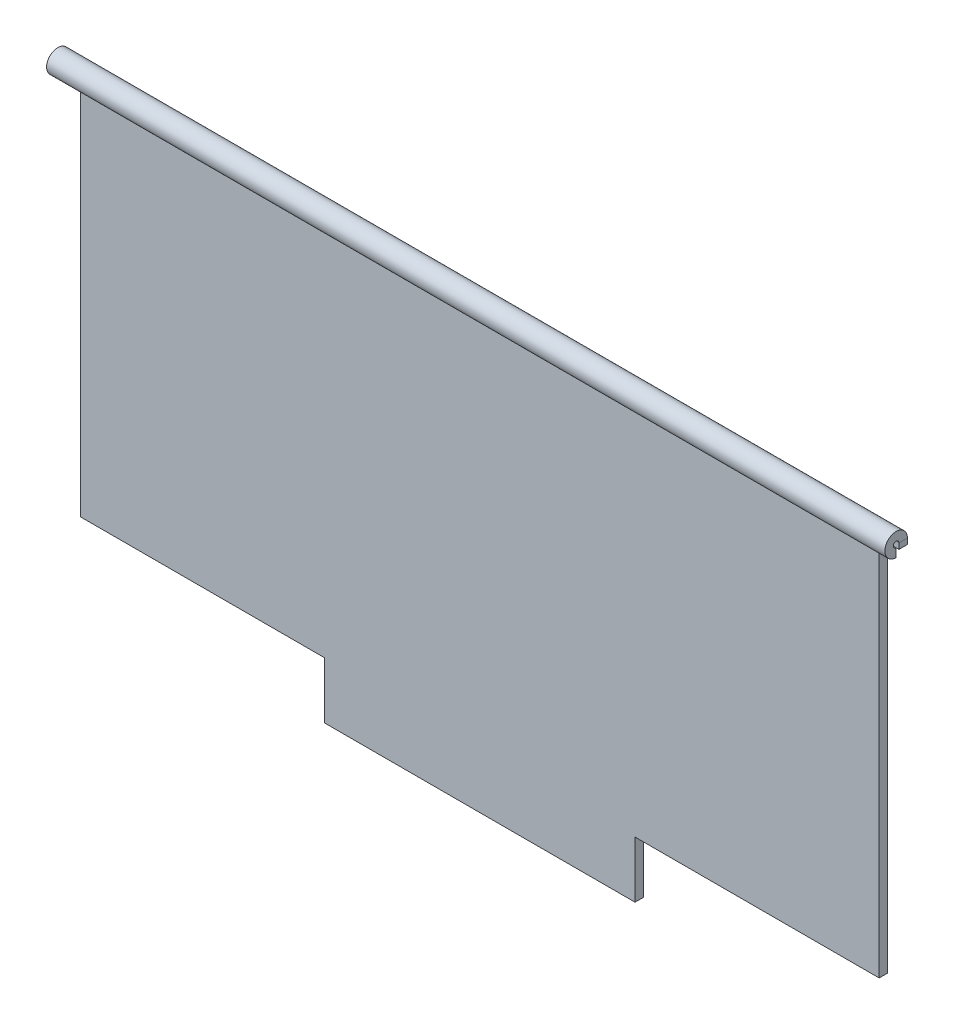
from build123d import *

# Parameters (mm, degrees)
BASE_FLANGE1_DEPTH = 3
HEM1_START         = -185.00035483
HEM1_DEPTH         = 297
HEM1_2_DEPTH       = 297


# Read off the part's stored shape, not the designer's step: Hem1
# Sheet-metal steps are written as plain solids
with BuildPart() as part:
    # Sketch1 → Base-Flange1 (new body)
    with BuildSketch(Plane.XY):
        Polygon((18.49964517, -243.314393939), (104.99964517, -243.314393939), (104.99964517, -108.314393939), (111.99964517, -108.314393939), (111.99964517, -102.314393939), (-185.00035483, -102.314393939), (-185.00035483, -108.314393939), (-178.00035483, -108.314393939), (-178.00035483, -243.314393939), (-91.50035483, -243.314393939), (-91.50035483, -263.314393939), (18.49964517, -263.314393939), align=None)
    extrude(amount=-BASE_FLANGE1_DEPTH)

    # Hem1 outline → Hem1 (cut)
    with BuildSketch(Plane.YZ.offset(HEM1_START)):
        with BuildLine():
            Line((-102.314393939, 0), (-102.441410593, 0))
            ThreePointArc((-102.441410593, 0), (-103.864904196, -2.16227766), (-106.314393939, -3))
            Line((-106.314393939, -3), (-102.314393939, -3))
            Line((-102.314393939, -3), (-102.314393939, 0))
        make_face()
    extrude(amount=HEM1_DEPTH, mode=Mode.SUBTRACT)

    # Hem1 2 outline → Hem1 2 (add)
    with BuildSketch(Plane.YZ.offset(HEM1_START)):
        with BuildLine():
            Line((-110.314393939, 1), (-107.314393939, 1))
            ThreePointArc((-107.314393939, 1), (-105.607287158, 1.707106781), (-106.314393939, 0))
            Line((-106.314393939, 0), (-102.441410593, 0))
            ThreePointArc((-102.441410593, 0), (-105.810376769, 4.968118785), (-110.314393939, 1))
        make_face()
    extrude(amount=HEM1_2_DEPTH)


solid = part.part
